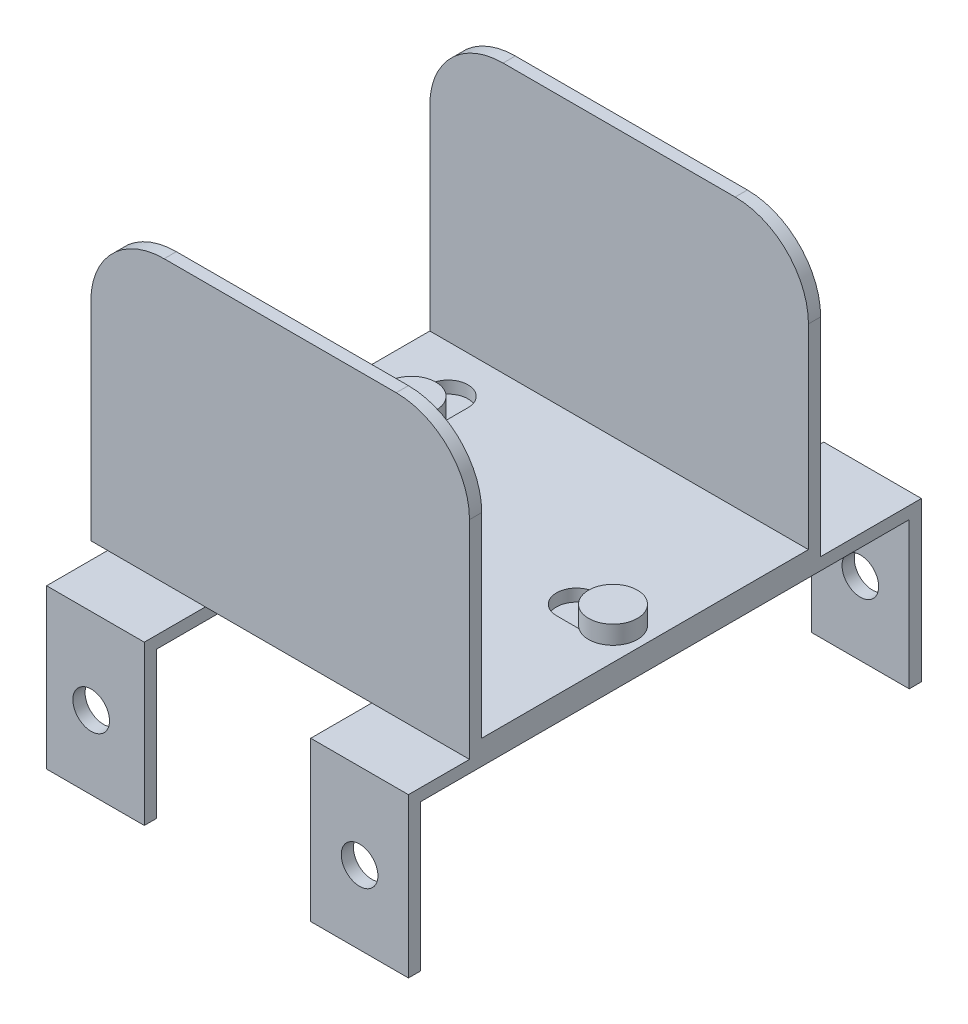
from build123d import *

# Parameters (mm, degrees)
SKETCH1_W               = 98.425
SKETCH1_H               = 91.28125
SKETCH1_R               = 5.159375
BOSS_EXTRUDE1_DEPTH     = 3.175
SKETCH2_W               = 25.4
SKETCH2_H               = 133.35
BOSS_EXTRUDE3_DEPTH     = 3.175
SKETCH3_W               = 25.4
SKETCH3_H               = 3.175
BOSS_EXTRUDE4_DEPTH     = 38.1
SKETCH4_R               = 4.7625
CUT_EXTRUDE1_DEPTH      = 171.802016235
BOSS_EXTRUDE5_START     = -9.525
SKETCH5_R               = 5.159375
BOSS_EXTRUDE5_DEPTH     = 9.525
SKETCH6_R               = 6.35
BOSS_EXTRUDE6_DEPTH     = 4.7625
SKETCH7_W               = 98.425
SKETCH7_H               = 3.175
BOSS_EXTRUDE7_DEPTH     = 69.85
CUT_EXTRUDE2_DEPTH      = 170.766035693
CUT_EXTRUDE2_DEPTH_BACK = 170.766035693


with BuildPart() as part:
    # Sketch1 → Boss-Extrude1 (new body)
    with BuildSketch(Plane(origin=(0, 0, 0), x_dir=(1, 0, 0), z_dir=(0, 1, 0))):
        with Locations((49.2125, 45.640625)):
            Rectangle(SKETCH1_W, SKETCH1_H)
        with Locations((17.065625, 45.640625)):
            Circle(SKETCH1_R, mode=Mode.SUBTRACT)
        with BuildLine():
            Line((11.90625, 66.278125), (11.90625, 75.803125))
            ThreePointArc((11.90625, 75.803125), (17.065625, 80.9625), (22.225, 75.803125))
            Line((22.225, 75.803125), (22.225, 66.278125))
            ThreePointArc((22.225, 66.278125), (17.065625, 61.11875), (11.90625, 66.278125))
        make_face(mode=Mode.SUBTRACT)
        with BuildLine():
            Line((11.90625, 25.003125), (11.90625, 15.478125))
            ThreePointArc((11.90625, 15.478125), (17.065625, 10.31875), (22.225, 15.478125))
            Line((22.225, 15.478125), (22.225, 25.003125))
            ThreePointArc((22.225, 25.003125), (17.065625, 30.1625), (11.90625, 25.003125))
        make_face(mode=Mode.SUBTRACT)
        with BuildLine():
            Line((80.565625, 50.8), (90.090625, 50.8))
            ThreePointArc((90.090625, 50.8), (95.25, 45.640625), (90.090625, 40.48125))
            Line((90.090625, 40.48125), (80.565625, 40.48125))
            ThreePointArc((80.565625, 40.48125), (75.40625, 45.640625), (80.565625, 50.8))
        make_face(mode=Mode.SUBTRACT)
    extrude(amount=BOSS_EXTRUDE1_DEPTH)

    # Sketch2 → Boss-Extrude3 (add)
    with BuildSketch(Plane.XZ):
        with Locations((17.065625, -50.8)):
            Rectangle(SKETCH2_W, SKETCH2_H)
        with Locations((85.725, -50.8)):
            Rectangle(SKETCH2_W, SKETCH2_H)
    extrude(amount=BOSS_EXTRUDE3_DEPTH)

    # Sketch3 → Boss-Extrude4 (add)
    with BuildSketch(Plane.XZ.offset(3.175)):
        with Locations((17.065625, 14.2875)):
            Rectangle(SKETCH3_W, SKETCH3_H)
        with Locations((17.065625, -115.8875)):
            Rectangle(SKETCH3_W, SKETCH3_H)
        with Locations((85.725, 14.2875)):
            Rectangle(SKETCH3_W, SKETCH3_H)
        with Locations((85.725, -115.8875)):
            Rectangle(SKETCH3_W, SKETCH3_H)
    extrude(amount=BOSS_EXTRUDE4_DEPTH)

    # Sketch4 → Cut-Extrude1 (cut, through all)
    with BuildSketch(Plane.XY.offset(15.875)):
        with Locations((15.95994836, -22.225)):
            Circle(SKETCH4_R)
        with Locations((85.725, -22.225)):
            Circle(SKETCH4_R)
    extrude(amount=-CUT_EXTRUDE1_DEPTH, mode=Mode.SUBTRACT)

    # Sketch5 → Boss-Extrude5 (add)
    with BuildSketch(Plane(origin=(0, 3.175, 0), x_dir=(1, 0, 0), z_dir=(0, 1, 0)).offset(BOSS_EXTRUDE5_START)):
        with Locations((17.065625, 45.640625)):
            Circle(SKETCH5_R)
        with Locations((17.065625, 66.278125)):
            Circle(SKETCH5_R)
        with Locations((90.090625, 45.640625)):
            Circle(SKETCH5_R)
    extrude(amount=BOSS_EXTRUDE5_DEPTH)

    # Sketch6 → Boss-Extrude6 (add)
    with BuildSketch(Plane(origin=(0, 3.175, 0), x_dir=(1, 0, 0), z_dir=(0, 1, 0))):
        with Locations((90.090625, 45.640625)):
            Circle(SKETCH6_R)
        with Locations((17.065625, 45.640625)):
            Circle(SKETCH6_R)
        with Locations((17.065625, 66.278125)):
            Circle(SKETCH6_R)
    extrude(amount=BOSS_EXTRUDE6_DEPTH)

    # Sketch7 → Boss-Extrude7 (add)
    with BuildSketch(Plane(origin=(0, 3.175, 0), x_dir=(1, 0, 0), z_dir=(0, 1, 0))):
        with Locations((49.2125, 89.69375)):
            Rectangle(SKETCH7_W, SKETCH7_H)
        with Locations((49.2125, 1.5875)):
            Rectangle(SKETCH7_W, SKETCH7_H)
    extrude(amount=BOSS_EXTRUDE7_DEPTH)

    # Sketch8 → Cut-Extrude2 (cut, two sides: drawn at the far end of the back side and taken through both)
    with BuildSketch(Plane.XY.offset(-CUT_EXTRUDE2_DEPTH_BACK)):
        with BuildLine():
            Line((79.375, 73.025), (98.425, 73.025))
            Line((98.425, 73.025), (98.425, 53.975))
            ThreePointArc((98.425, 53.975), (92.845384182, 67.445384182), (79.375, 73.025))
        make_face()
        with BuildLine():
            Line((19.05, 73.025), (0, 73.025))
            Line((0, 73.025), (0, 53.975))
            ThreePointArc((0, 53.975), (5.579615818, 67.445384182), (19.05, 73.025))
        make_face()
    extrude(amount=CUT_EXTRUDE2_DEPTH + CUT_EXTRUDE2_DEPTH_BACK, mode=Mode.SUBTRACT)


solid = part.part
